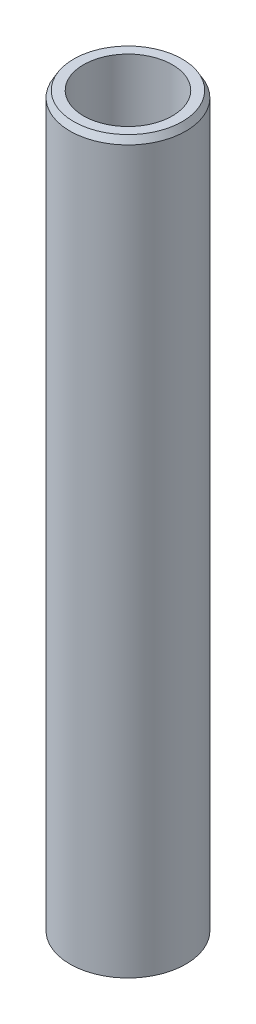
from build123d import *
from OCP.BRepFilletAPI import BRepFilletAPI_MakeChamfer

# Parameters (mm, degrees)
SKETCH1_R           = 45
BOSS_EXTRUDE1_DEPTH = 568.066885724
SKETCH2_R           = 34.498313642
CUT_EXTRUDE1_DEPTH  = 572.620491809
CHAMFER1_SIZE       = 4.94920011
CHAMFER1_SIZE2      = 2.857422016


with BuildPart() as part:
    # Sketch1 → Boss-Extrude1 (new body)
    with BuildSketch(Plane(origin=(0, 0, 0), x_dir=(1, 0, 0), z_dir=(0, 1, 0))):
        Circle(SKETCH1_R)
    extrude(amount=BOSS_EXTRUDE1_DEPTH)

    # Sketch2 → Cut-Extrude1 (cut, through all)
    with BuildSketch(Plane(origin=(0, 0, 0), x_dir=(1, 0, 0), z_dir=(0, 1, 0))):
        Circle(SKETCH2_R)
    extrude(amount=CUT_EXTRUDE1_DEPTH, mode=Mode.SUBTRACT)

    # Chamfer1: one chamfer whose edges measure the first distance from different faces: ONE call of the kernel's chamfer builder (chamfer() names one face for all edges)
    chamfer1_edges_1 = [part.edges().sort_by_distance(p)[0] for p in [
        (-45, 568.066885724, 0),
    ]]
    chamfer1_side_1 = [part.faces().sort_by_distance(p)[0] for p in [
        (-45, 284.033442862, 0),
    ]]
    chamfer1_edges_2 = [part.edges().sort_by_distance(p)[0] for p in [
        (-45, 0, 0),
    ]]
    chamfer1_side_2 = [part.faces().sort_by_distance(p)[0] for p in [
        (-43.727207794, 0, 0),
    ]]
    chamfer1 = BRepFilletAPI_MakeChamfer(part.part.solid().wrapped)
    for e in chamfer1_edges_1:
        chamfer1.Add(CHAMFER1_SIZE, CHAMFER1_SIZE2, e.wrapped, chamfer1_side_1[0].wrapped)  # the first distance lies on this face
    for e in chamfer1_edges_2:
        chamfer1.Add(CHAMFER1_SIZE, CHAMFER1_SIZE2, e.wrapped, chamfer1_side_2[0].wrapped)  # the first distance lies on this face
    add(Compound.cast(chamfer1.Shape()), mode=Mode.REPLACE)


solid = part.part
